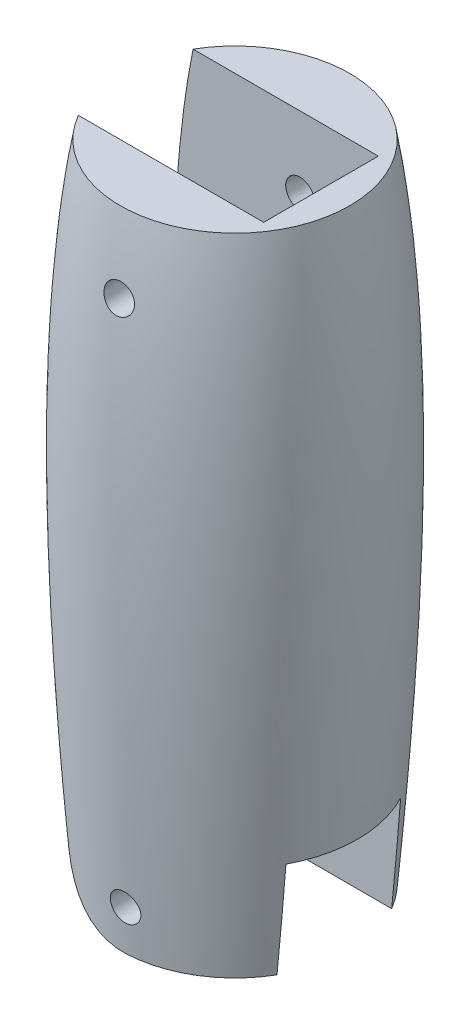
from build123d import *

# Parameters (mm, degrees)
CUT_EXTRUDE1_DEPTH      = 6
CUT_EXTRUDE1_DEPTH_BACK = 27.06372692
SKETCH2_W               = 8
SKETCH2_H               = 13
SKETCH2_H_2             = 12
CUT_EXTRUDE2_DEPTH      = 27.06372692
CUT_EXTRUDE2_DEPTH_BACK = 27.06372692
SKETCH3_R               = 1
CUT_EXTRUDE4_START      = 10
CUT_EXTRUDE4_DEPTH      = 20
SKETCH7_R               = 0.5
CUT_EXTRUDE5_DEPTH      = 35.598668513
SKETCH8_W               = 7.99991565
SKETCH8_H               = 7
CUT_EXTRUDE6_DEPTH      = 29.756672237


with BuildPart() as part:
    # Sketch1 → Revolve1 (revolve)
    with BuildSketch(Plane(origin=(0, 0, 0), x_dir=(0, 0, -1), z_dir=(1, 0, 0))):
        with BuildLine():
            Line((0, 22.5), (0, -22.5))
            Line((0, -22.5), (8, -22.5))
            add(Edge.make_bspline(
                [(8, 22.5), (10.604722665, 7.727883705), (8, -22.5)],
                knots=[0, 0, 0, 1, 1, 1], degree=2))
            Line((8, 22.5), (0, 22.5))
        make_face()
    revolve(axis=Axis((0, 22.5, 0), (0, -1, 0)))

    # Sketch2 → Cut-Extrude1 (cut, two sides: drawn at the far end of the back side and taken through both)
    with BuildSketch(Plane(origin=(0, 0, 0), x_dir=(0, 0, -1), z_dir=(1, 0, 0)).offset(-CUT_EXTRUDE1_DEPTH_BACK)):
        with Locations((0, 16)):
            Rectangle(SKETCH2_W, SKETCH2_H)
        with Locations((0, -16.5)):
            Rectangle(SKETCH2_W, SKETCH2_H_2)
    extrude(amount=CUT_EXTRUDE1_DEPTH + CUT_EXTRUDE1_DEPTH_BACK, mode=Mode.SUBTRACT)

    # Sketch3 → Cut-Extrude2 (cut, two sides: drawn at the far end of the back side and taken through both)
    with BuildSketch(Plane.XY.offset(-CUT_EXTRUDE2_DEPTH_BACK)):
        with Locations((0.535898385, 17.5)):
            Circle(SKETCH3_R)
        with Locations((0.535898385, -19.5)):
            Circle(SKETCH3_R)
    extrude(amount=CUT_EXTRUDE2_DEPTH + CUT_EXTRUDE2_DEPTH_BACK, mode=Mode.SUBTRACT)

    # Sketch5 → Cut-Extrude4 (cut)
    with BuildSketch(Plane.XY.offset(CUT_EXTRUDE4_START)):
        with BuildLine():
            add(Edge.make_bspline(
                [(-7.584243459, -15.120716805), (-7.392642157, -17.582692325), (-7.172739088, -20.042353376), (-6.92820323, -22.5)],
                knots=[0.384703821, 0.384703821, 0.384703821, 0.384703821, 1, 1, 1, 1], degree=3))
            Line((-6.92820323, -22.5), (0.391639605, -22.5))
            ThreePointArc((0.391639605, -22.5), (-5.041327612, -20.372211442), (-7.584243459, -15.120716805))
        make_face()
    extrude(amount=-CUT_EXTRUDE4_DEPTH, mode=Mode.SUBTRACT)

    # Sketch7 → Cut-Extrude5 (cut, through all)
    with BuildSketch(Plane(origin=(0, 9.5, 0), x_dir=(1, 0, 0), z_dir=(0, 1, 0))):
        with Locations((-3, 0)):
            Circle(SKETCH7_R)
        with Locations((4, 0)):
            Circle(SKETCH7_R)
    extrude(amount=-CUT_EXTRUDE5_DEPTH, mode=Mode.SUBTRACT)

    # Sketch8 → Cut-Extrude6 (cut, through all)
    with BuildSketch(Plane.ZY.offset(-6)):
        with Locations((-4.2175e-05, -19)):
            Rectangle(SKETCH8_W, SKETCH8_H)
    extrude(amount=-CUT_EXTRUDE6_DEPTH, mode=Mode.SUBTRACT)


solid = part.part
